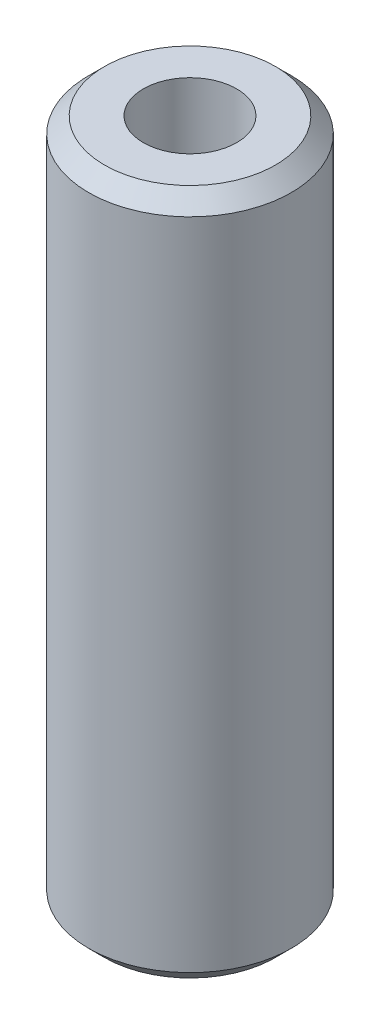
from build123d import *

# Parameters (mm, degrees)
SKETCH1_R           = 35
BOSS_EXTRUDE1_DEPTH = 236.98215736
SKETCH2_R           = 16.112301455
CUT_EXTRUDE1_DEPTH  = 243.096143933
CHAMFER1_SIZE       = 5.490320133


with BuildPart() as part:
    # Sketch1 → Boss-Extrude1 (new body)
    with BuildSketch(Plane(origin=(0, 0, 0), x_dir=(1, 0, 0), z_dir=(0, 1, 0))):
        Circle(SKETCH1_R)
    extrude(amount=BOSS_EXTRUDE1_DEPTH)

    # Sketch2 → Cut-Extrude1 (cut, through all)
    with BuildSketch(Plane(origin=(0, 0, 0), x_dir=(1, 0, 0), z_dir=(0, 1, 0))):
        Circle(SKETCH2_R)
    extrude(amount=CUT_EXTRUDE1_DEPTH, mode=Mode.SUBTRACT)

    # Chamfer1
    chamfer1_edges = [part.edges().sort_by_distance(p)[0] for p in [
        (-35, 236.98215736, 0),
        (-35, 0, 0),
    ]]
    chamfer(chamfer1_edges, length=CHAMFER1_SIZE)


solid = part.part
